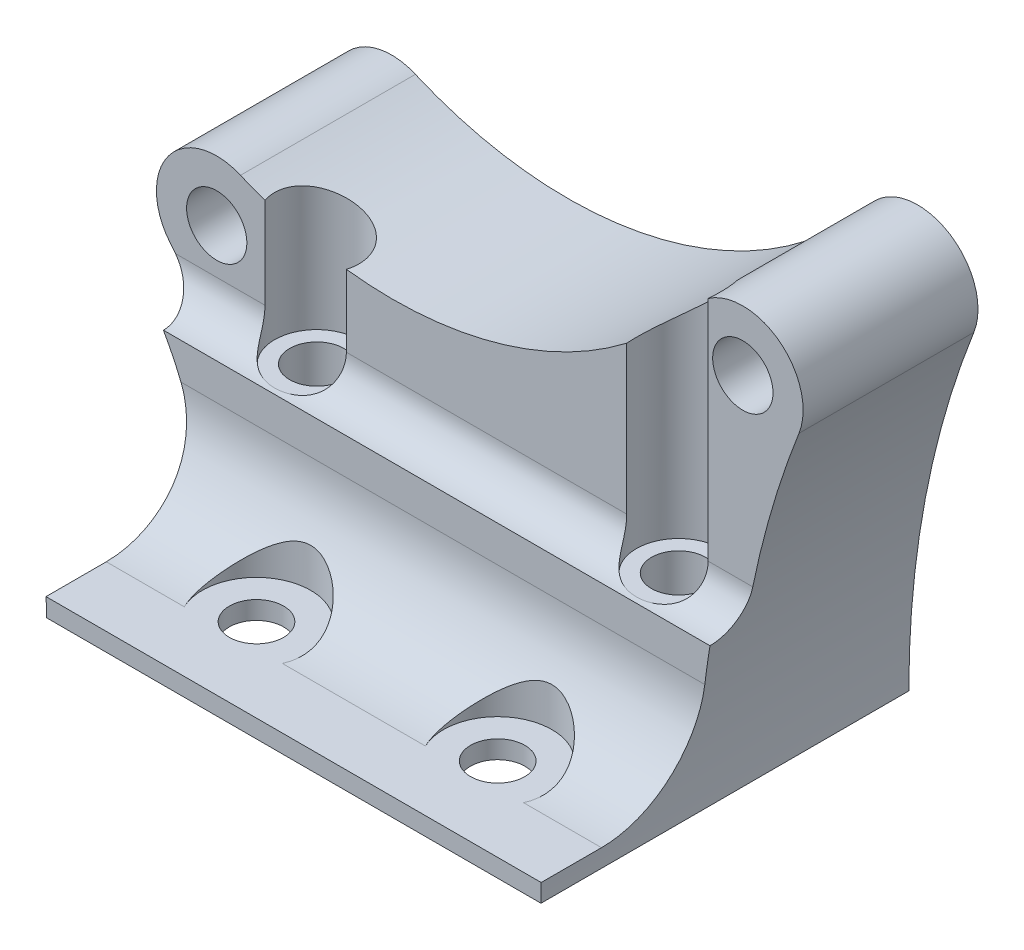
from build123d import *

# Parameters (mm, degrees)
SZKIC1_R                                            = 5
DODANIE_WYCI_GNI_CIE1_DEPTH                         = 27.7
DODANIE_WYCI_GNI_CIE2_REACH                         = 119.853
DODANIE_WYCI_GNI_CIE2_END_RADIUS                    = 50.543324632
WYTNIJ_WYCI_GNI_CIE1_START                          = -20.3
WYTNIJ_WYCI_GNI_CIE1_DEPTH                          = 20.3
POG_BIENIE_WALCOWE_POD_M8_WKR_T_Z_BEM_S_D           = 9
POG_BIENIE_WALCOWE_POD_M8_WKR_T_Z_BEM_S_CBORE_D     = 18.011
POG_BIENIE_WALCOWE_POD_M8_WKR_T_Z_BEM_S_CBORE_DEPTH = 20.3
POG_BIENIE_WALCOWE_POD_M8_WKR_T_Z_B_2_D             = 9
POG_BIENIE_WALCOWE_POD_M8_WKR_T_Z_B_2_CBORE_D       = 18.011
POG_BIENIE_WALCOWE_POD_M8_WKR_T_Z_B_2_CBORE_DEPTH   = 57.54
BOSS_EXTRUDE1_START                                 = -33.3
SZKIC1_3_R                                          = 5
BOSS_EXTRUDE1_DEPTH                                 = 29
CUT_EXTRUDE2_DEPTH                                  = 108
CUT_EXTRUDE2_DEPTH_BACK                             = 159.117676945
SKETCH2_W                                           = 40.96608473
SKETCH2_H                                           = 87.575474611
BOSS_EXTRUDE3_DEPTH                                 = 6
FILLET4_R                                           = 16
WYTNIJ_WYCI_GNI_CIE2_DEPTH                          = 59
WYTNIJ_WYCI_GNI_CIE2_DEPTH_BACK                     = 1
WYTNIJ_WYCI_GNI_CIE2_START                          = 23
SKETCH10_W                                          = 122.118051979
SKETCH10_H                                          = 32
ZAOKR_GLENIE7_R                                     = 6
SKETCH4_R                                           = 4.5
WYTNIJ_WYCI_GNI_CIE3_DEPTH                          = 125.666566055
WYTNIJ_WYCI_GNI_CIE4_START                          = -25
SZKIC14_R                                           = 7
WYTNIJ_WYCI_GNI_CIE4_DEPTH                          = 100.666566055
SZKIC15_R                                           = 9
WYTNIJ_WYCI_GNI_CIE5_DEPTH                          = 123.993953938


# Some blends are built 0.0001 mm under size
with BuildPart() as part:
    # Szkic1 → Dodanie-wyciągnięcie1 (new body)
    with BuildSketch(Plane.XY):
        with BuildLine():
            Line((-1.469986393, -60.54), (-83.469986393, -60.54))
            ThreePointArc((-83.469986393, -60.54), (-86.43214098, -43.49124867), (-94.971403209, -28.440824015))
            ThreePointArc((-94.971403209, -28.440824015), (-95.242829308, -16.084497343), (-83.300365534, -12.901724973))
            ThreePointArc((-83.300365534, -12.901724973), (-42.333721248, -16.139046942), (-7.843535904, 6.203139892))
            ThreePointArc((-7.843535904, 6.203139892), (4.984530504, 8.669166953), (9.306965288, -3.657922516))
            ThreePointArc((9.306965288, -3.657922516), (1.248004894, -31.593007814), (-1.469986393, -60.54))
        make_face()
        with Locations((-87.246959259, -22.09)):
            Circle(SZKIC1_R, mode=Mode.SUBTRACT)
        Circle(SZKIC1_R, mode=Mode.SUBTRACT)
    extrude(amount=DODANIE_WYCI_GNI_CIE1_DEPTH)

    # Dodanie-wyciągnięcie2: up to this cylinder (the profile starts outside it)
    dodanie_wyci_gni_cie2_end = Plane(origin=(-134.013311026, -60.54, -7.031173), z_dir=(0, 0, -1)) * Cylinder(DODANIE_WYCI_GNI_CIE2_END_RADIUS, 341.792649265, mode=Mode.PRIVATE)
    # Szkic3 → Dodanie-wyciągnięcie2 (add, up to the surface)
    with BuildSketch(Plane(origin=(0, 0, 0), x_dir=(0, 0, -1), z_dir=(1, 0, 0)), mode=Mode.PRIVATE) as dodanie_wyci_gni_cie2_sk1:
        with BuildLine():
            Line((0, -60.54), (0, -41.54))
            ThreePointArc((0, -41.54), (4.686291501, -52.853708499), (16, -57.54))
            Line((16, -57.54), (20.3, -57.54))
            Line((20.3, -57.54), (20.3, -60.54))
            Line((20.3, -60.54), (0, -60.54))
        make_face()
    dodanie_wyci_gni_cie2_tool1 = extrude(dodanie_wyci_gni_cie2_sk1.sketch, amount=-DODANIE_WYCI_GNI_CIE2_REACH, mode=Mode.PRIVATE) - dodanie_wyci_gni_cie2_end
    add(dodanie_wyci_gni_cie2_tool1.solids().sort_by_distance((0, -56.633627, -7.031173))[0])

    # Szkic4 → Wytnij-wyciągnięcie1 (cut)
    with BuildSketch(Plane.XY.offset(WYTNIJ_WYCI_GNI_CIE1_START)):
        with BuildLine():
            Line((-1.469986393, -60.54), (0, -60.54))
            Line((0, -60.54), (0, -41.54))
            Line((0, -41.54), (-0.304878126, -41.54))
            ThreePointArc((-0.304878126, -41.54), (-1.178436016, -51.022155217), (-1.469986393, -60.54))
        make_face()
    extrude(amount=WYTNIJ_WYCI_GNI_CIE1_DEPTH, mode=Mode.SUBTRACT)

    # Pog_bienie walcowe pod M8 Wkr_t z _bem s (through all)
    with Locations(Plane(origin=(0, 0, 0), x_dir=(1, 0, 0), z_dir=(0, 1, 0))):
        with Locations((-62.500071487, -13.85), (-22.500071487, -13.85)):
            CounterBoreHole(POG_BIENIE_WALCOWE_POD_M8_WKR_T_Z_BEM_S_D / 2, POG_BIENIE_WALCOWE_POD_M8_WKR_T_Z_BEM_S_CBORE_D / 2, POG_BIENIE_WALCOWE_POD_M8_WKR_T_Z_BEM_S_CBORE_DEPTH)

    # Pog_bienie walcowe pod M8 Wkr_t z _b 2 (through all)
    with Locations(Plane(origin=(0, 0, 0), x_dir=(1, 0, 0), z_dir=(0, 1, 0))):
        with Locations((-72.500071487, 10.15), (-12.500071487, 10.15)):
            CounterBoreHole(POG_BIENIE_WALCOWE_POD_M8_WKR_T_Z_B_2_D / 2, POG_BIENIE_WALCOWE_POD_M8_WKR_T_Z_B_2_CBORE_D / 2, POG_BIENIE_WALCOWE_POD_M8_WKR_T_Z_B_2_CBORE_DEPTH)

    # Szkic1<3> → Boss-Extrude1 (add)
    with BuildSketch(Plane.XY.offset(BOSS_EXTRUDE1_START)):
        with BuildLine():
            Line((-1.469986393, -60.54), (-83.469986393, -60.54))
            ThreePointArc((-83.469986393, -60.54), (-86.43214098, -43.49124867), (-94.971403209, -28.440824015))
            ThreePointArc((-94.971403209, -28.440824015), (-95.242829308, -16.084497343), (-83.300365534, -12.901724973))
            ThreePointArc((-83.300365534, -12.901724973), (-42.333721248, -16.139046942), (-7.843535904, 6.203139892))
            ThreePointArc((-7.843535904, 6.203139892), (4.984530504, 8.669166953), (9.306965288, -3.657922516))
            ThreePointArc((9.306965288, -3.657922516), (1.248004894, -31.593007814), (-1.469986393, -60.54))
        make_face()
        with Locations((-87.246959259, -22.09)):
            Circle(SZKIC1_3_R, mode=Mode.SUBTRACT)
        Circle(SZKIC1_3_R, mode=Mode.SUBTRACT)
    extrude(amount=BOSS_EXTRUDE1_DEPTH)

    # Sketch2 → Cut-Extrude2 (cut, two sides: drawn at the far end of the back side and taken through both)
    with BuildSketch(Plane(origin=(0, 0, 0), x_dir=(0, 0, -1), z_dir=(1, 0, 0)).offset(-CUT_EXTRUDE2_DEPTH_BACK)):
        with Locations((-16.183042365, -13.752262695)):
            Rectangle(SKETCH2_W, SKETCH2_H)
    extrude(amount=CUT_EXTRUDE2_DEPTH + CUT_EXTRUDE2_DEPTH_BACK, mode=Mode.SUBTRACT)

    # Sketch9 → Boss-Extrude3 (add)
    with BuildSketch(Plane.XY.offset(-4.3)):
        with BuildLine():
            Line((-83.559097476, -57.54), (-1.441045497, -57.54))
            ThreePointArc((-1.441045497, -57.54), (1.534351464, -30.120504033), (9.306965288, -3.657922516))
            ThreePointArc((9.306965288, -3.657922516), (4.984530504, 8.669166953), (-7.843535904, 6.203139892))
            ThreePointArc((-7.843535904, 6.203139892), (-42.333721248, -16.139046942), (-83.300365534, -12.901724973))
            ThreePointArc((-83.300365534, -12.901724973), (-95.242829308, -16.084497343), (-94.971403209, -28.440824015))
            ThreePointArc((-94.971403209, -28.440824015), (-86.959305398, -42.086051391), (-83.559097476, -57.54))
        make_face()
    extrude(amount=BOSS_EXTRUDE3_DEPTH)

    # Fillet4
    # the kernel refuses this fillet: 16 mm, written as the material it adds along each edge
    with BuildSketch(Plane(origin=(-123.559097476, -57.54, 1.7), x_dir=(0, 0, 1), z_dir=(1, 0, 0))) as fillet4_piece_1_section:
        with BuildLine():
            CenterArc((FILLET4_R, -FILLET4_R), FILLET4_R, 90, 90)
            Line((0, -FILLET4_R), (0, 0))
            Line((0, 0), (FILLET4_R, 0))
        make_face()
    fillet4_piece_1 = extrude(amount=162.11805198, mode=Mode.PRIVATE)
    fillet4_piece_1 = fillet4_piece_1 - Plane(origin=(154.033792672, -60.54, 5.140185236), x_dir=(-0.9925075244175049, 0.12218352579065733, 0), z_dir=(0, 0, -1)) * Cylinder(155.503779066, 389, mode=Mode.PRIVATE)
    fillet4_piece_1 = fillet4_piece_1 - Plane(origin=(-62.500071487, -53.808820889, 13.85), x_dir=(-1, 0, 0), z_dir=(0, -1, 0)) * Cylinder(4.5, 389, mode=Mode.PRIVATE)
    fillet4_piece_1 = fillet4_piece_1 - Plane(origin=(-22.500071487, -53.808820889, 13.85), x_dir=(-1, 0, 0), z_dir=(0, -1, 0)) * Cylinder(4.5, 389, mode=Mode.PRIVATE)
    fillet4_piece_1 = fillet4_piece_1 - Plane(origin=(-134.013311026, -60.54, 5.140185236), x_dir=(-1, 0, 0), z_dir=(0, 0, -1)) * Cylinder(50.543324632, 389, mode=Mode.PRIVATE)
    add(fillet4_piece_1)

    # Sketch10 → Wytnij-wyciągnięcie2 (cut, two sides: drawn at the far end of the back side and taken through both)
    with BuildSketch(Plane(origin=(0, -57.54, 0), x_dir=(1, 0, 0), z_dir=(0, 1, 0)).offset(WYTNIJ_WYCI_GNI_CIE2_START - WYTNIJ_WYCI_GNI_CIE2_DEPTH_BACK)):
        with Locations((-42.500071487, -11.7)):
            Rectangle(SKETCH10_W, SKETCH10_H)
    extrude(amount=WYTNIJ_WYCI_GNI_CIE2_DEPTH + WYTNIJ_WYCI_GNI_CIE2_DEPTH_BACK, mode=Mode.SUBTRACT)

    # Zaokrąglenie7
    zaokr_glenie7_edges = [part.edges().sort_by_distance(p)[0] for p in [
        (-44.766508406, -35.54, -4.3),
    ]]
    fillet(zaokr_glenie7_edges, radius=ZAOKR_GLENIE7_R - 0.0001)  # a hair under: the kernel refuses the full size

    # Sketch4 → Wytnij-wyciągnięcie3 (cut, through all)
    with BuildSketch(Plane(origin=(0, -60.54, 0), x_dir=(-1, 0, 0), z_dir=(0, -1, 0))):
        with Locations(Location((12.500071487, 6.15, 0), (0, 0, 90))):
            Circle(SKETCH4_R)
        with Locations(Location((72.500071487, 6.15, 0), (0, 0, 90))):
            Circle(SKETCH4_R)
    extrude(amount=-WYTNIJ_WYCI_GNI_CIE3_DEPTH, mode=Mode.SUBTRACT)

    # Szkic14 → Wytnij-wyciągnięcie4 (cut, through all)
    with BuildSketch(Plane.XZ.offset(60.54).offset(WYTNIJ_WYCI_GNI_CIE4_START)):
        with Locations(Location((-72.500071487, -6.15, 0), (0, 0, 270))):
            Circle(SZKIC14_R)
        with Locations(Location((-12.500071487, -6.15, 0), (0, 0, 270))):
            Circle(SZKIC14_R)
    extrude(amount=-WYTNIJ_WYCI_GNI_CIE4_DEPTH, mode=Mode.SUBTRACT)

    # Szkic15 → Wytnij-wyciągnięcie5 (cut, through all)
    with BuildSketch(Plane(origin=(0, -57.54, 0), x_dir=(1, 0, 0), z_dir=(0, 1, 0))):
        with Locations((-62.500071487, -13.85)):
            Circle(SZKIC15_R)
        with Locations((-22.500071487, -13.85)):
            Circle(SZKIC15_R)
    extrude(amount=WYTNIJ_WYCI_GNI_CIE5_DEPTH, mode=Mode.SUBTRACT)


solid = part.part
